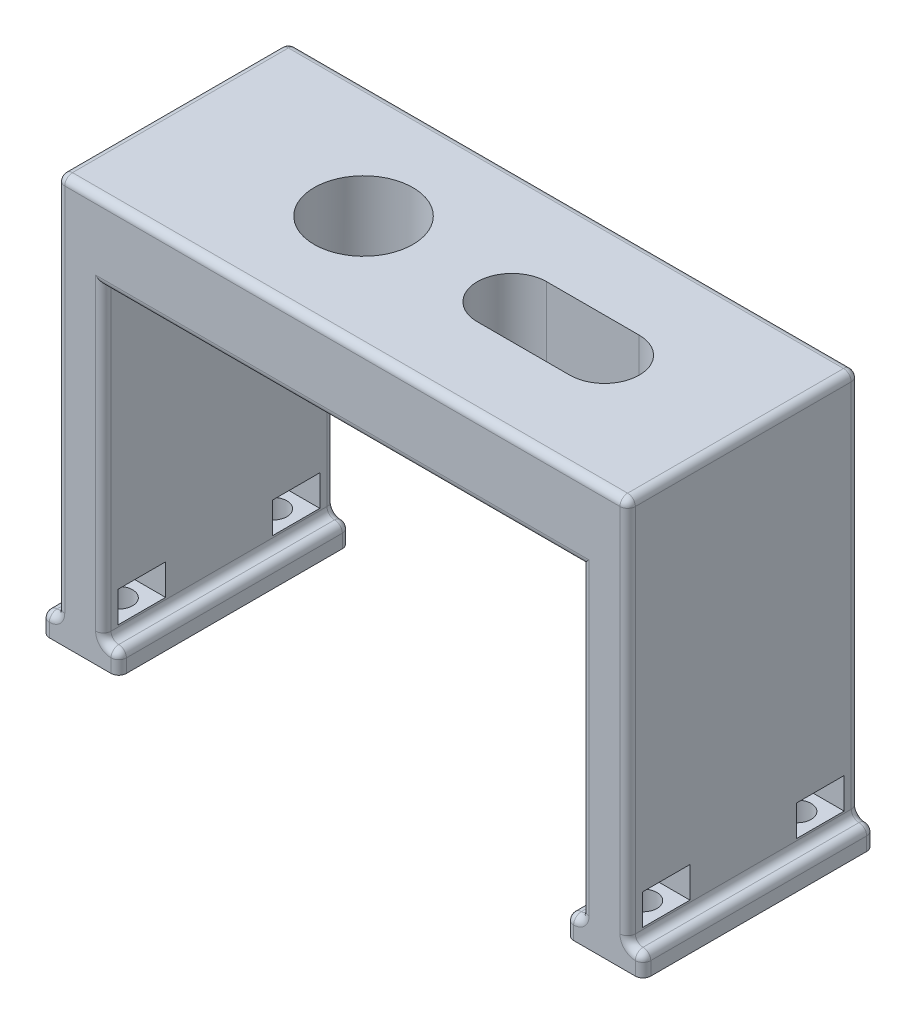
from build123d import *

# Parameters (mm, degrees)
SKETCH1_W                     = 74
SKETCH1_H                     = 30
BOSS_EXTRUDE1_DEPTH           = 10
SKETCH2_R                     = 6.4
CUT_EXTRUDE1_DEPTH            = 15
BOSS_EXTRUDE2_DEPTH           = 30
M3_CLEARANCE_HOLE1_AT_2_COUNT = 2
M3_CLEARANCE_HOLE1_AT_2_PITCH = 20
CUT_EXTRUDE2_REACH            = 92.574
SKETCH10_W                    = 6.16
SKETCH10_H                    = 4
FILLET1_R                     = 1
CUT_EXTRUDE3_REACH            = 99.255


with BuildPart() as part:
    # Sketch1 → Boss-Extrude1 (new body)
    with BuildSketch(Plane(origin=(0, 0, 0), x_dir=(1, 0, 0), z_dir=(0, 1, 0))):
        with Locations((37, 15)):
            Rectangle(SKETCH1_W, SKETCH1_H)
    extrude(amount=BOSS_EXTRUDE1_DEPTH)

    # Sketch2 → Cut-Extrude1 (cut)
    with BuildSketch(Plane(origin=(0, 10, 0), x_dir=(1, 0, 0), z_dir=(0, 1, 0))):
        with Locations(Location((24.75, 15, 0), (0, 0, 270))):
            Circle(SKETCH2_R)
    extrude(amount=-CUT_EXTRUDE1_DEPTH, mode=Mode.SUBTRACT)

    # Sketch3 → Boss-Extrude2 (add)
    with BuildSketch(Plane.XY):
        Polygon((6, -40), (8, -40), (8, -42.75), (-2, -42.75), (-2, -40), (0, -40), (0, 0), (6, 0), align=None)
    boss_extrude2 = extrude(amount=-BOSS_EXTRUDE2_DEPTH)

    # Sketch9 → M3 Clearance Hole1 (revolve, cut)
    with BuildSketch(Plane(origin=(3, -42.75, -5), x_dir=(0, 0, -1), z_dir=(1, 0, 0))):
        Polygon((0, 0), (0, 11.081549114), (1.8, 10), (1.8, 0), align=None)
    m3_clearance_hole1 = revolve(axis=Axis((3, -49.1, -5), (0, 1, 0)), mode=Mode.SUBTRACT)

    # M3 Clearance Hole1 at 2: M3 Clearance Hole1 ×2
    with Locations(*[(0, 0, -i * M3_CLEARANCE_HOLE1_AT_2_PITCH) for i in range(1, M3_CLEARANCE_HOLE1_AT_2_COUNT)]):
        add(m3_clearance_hole1, mode=Mode.SUBTRACT)

    # Sketch10 → Cut-Extrude2 (cut, up to next)
    with BuildSketch(Plane.ZY, mode=Mode.PRIVATE) as cut_extrude2_sk1:
        with Locations((-25, -36.75)):
            Rectangle(SKETCH10_W, SKETCH10_H)
    cut_extrude2_tool1 = extrude(cut_extrude2_sk1.sketch, amount=-CUT_EXTRUDE2_REACH, mode=Mode.PRIVATE) & part.part
    # Sketch10 → Cut-Extrude2 (cut, up to next)
    with BuildSketch(Plane.ZY, mode=Mode.PRIVATE) as cut_extrude2_sk2:
        with Locations((-5, -36.75)):
            Rectangle(SKETCH10_W, SKETCH10_H)
    cut_extrude2_tool2 = extrude(cut_extrude2_sk2.sketch, amount=-CUT_EXTRUDE2_REACH, mode=Mode.PRIVATE) & part.part
    cut_extrude2_1 = cut_extrude2_tool1.solids().sort_by_distance((0, -36.75, -25))[0]
    add(cut_extrude2_1, mode=Mode.SUBTRACT)
    cut_extrude2_2 = cut_extrude2_tool2.solids().sort_by_distance((0, -36.75, -5))[0]
    add(cut_extrude2_2, mode=Mode.SUBTRACT)
    cut_extrude2 = cut_extrude2_1 + cut_extrude2_2  # Cut-Extrude2 as one shape, for the pattern or mirror that repeats it

    # Mirror1: Boss-Extrude2, M3 Clearance Hole1, Cut-Extrude2 across plane
    add(boss_extrude2.mirror(Plane.ZY.offset(-37)))
    add(m3_clearance_hole1.mirror(Plane.ZY.offset(-37)), mode=Mode.SUBTRACT)
    add(cut_extrude2.mirror(Plane.ZY.offset(-37)), mode=Mode.SUBTRACT)

    # Mirror1 copy 1 sketch → Mirror1 copy 1 (revolve, cut)
    with BuildSketch(Plane(origin=(71, -42.75, -25), x_dir=(0, 0, -1), z_dir=(-1, 0, 0))):
        Polygon((0, 0), (0, -11.081549114), (1.8, -10), (1.8, 0), align=None)
    revolve(axis=Axis((71, -49.1, -25), (0, -1, 0)), mode=Mode.SUBTRACT)

    # Fillet1
    fillet1_edges = [part.edges().sort_by_distance(p)[0] for p in [
        (74, -40, -15),
        (68, -40, -15),
        (6, -40, -15),
        (0, -40, -15),
    ]]
    fillet(fillet1_edges, radius=FILLET1_R)
    fillet1_2_edges = [part.edges().sort_by_distance(p)[0] for p in [
        (66, -41.375, 0),
        (66, -41.375, -30),
        (76, -41.375, 0),
        (76, -41.375, -30),
        (76, -40, -15),
        (66, -40, -15),
        (8, -41.375, 0),
        (8, -41.375, -30),
        (8, -40, -15),
        (-2, -41.375, -30),
        (-2, -41.375, 0),
        (-2, -40, -15),
        (74, -14.5, 0),
        (68, -19.5, 0),
        (68, -19.5, -30),
        (37, 0, 0),
        (6, -19.5, 0),
        (0, -14.5, 0),
        (74, 10, -15),
        (37, 10, 0),
        (0, 10, -15),
        (74, -14.5, -30),
        (0, -14.5, -30),
        (6, -19.5, -30),
        (37, 0, -30),
        (37, 10, -30),
        (6.292893219, -39.707106781, -30),
        (-0.292893219, -39.707106781, -30),
        (74.292893219, -39.707106781, -30),
        (-0.292893219, -39.707106781, 0),
        (6.292893219, -39.707106781, 0),
        (67.707106781, -39.707106781, -30),
        (67.707106781, -39.707106781, 0),
        (74.292893219, -39.707106781, 0),
    ]]
    fillet(fillet1_2_edges, radius=FILLET1_R - 0.0001)  # a hair under: the kernel refuses the full size

    # Sketch11 → Cut-Extrude3 (cut, up to next)
    with BuildSketch(Plane(origin=(0, 10, 0), x_dir=(1, 0, 0), z_dir=(0, 1, 0)), mode=Mode.PRIVATE) as cut_extrude3_sk1:
        with BuildLine():
            Line((44, 19.5), (56, 19.5))
            ThreePointArc((56, 19.5), (60.5, 15), (56, 10.5))
            Line((56, 10.5), (44, 10.5))
            ThreePointArc((44, 10.5), (39.5, 15), (44, 19.5))
        make_face()
    cut_extrude3_tool1 = extrude(cut_extrude3_sk1.sketch, amount=-CUT_EXTRUDE3_REACH, mode=Mode.PRIVATE) & part.part
    add(cut_extrude3_tool1.solids().sort_by_distance((50, 10, -15))[0], mode=Mode.SUBTRACT)


solid = part.part
